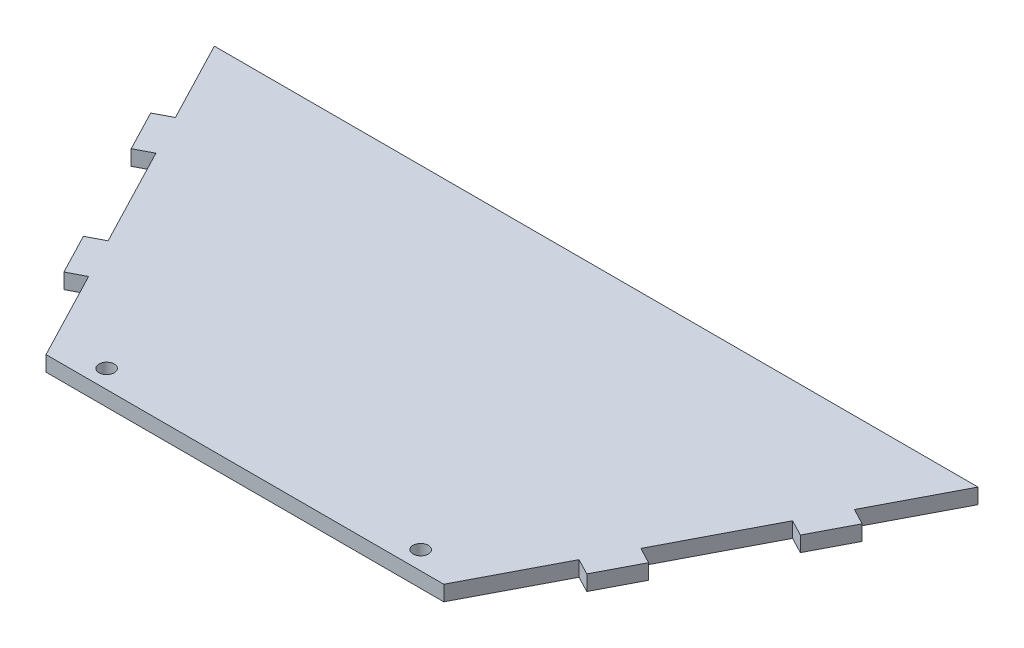
from build123d import *

# Parameters (mm, degrees)
EXTRUDE_1_DEPTH     = 5
SKETCH_2_R          = 2.5
CUT_EXTRUDE_1_DEPTH = 10


with BuildPart() as part:
    # 草图1 → 凸台-拉伸1 (new body)
    with BuildSketch(Plane(origin=(0, 0, 0), x_dir=(1, 0, 0), z_dir=(0, 1, 0))):
        Polygon((-65.115, -61.128005806), (65.115, -61.128005806), (80.27263574, -32.020080448), (85.594325618, -34.791292608), (92.522356018, -21.487067911), (87.200666139, -18.715855751), (104.215908801, 13.959320104), (109.53759868, 11.188107944), (116.465629079, 24.492332641), (111.143939201, 27.263544801), (125, 53.871994194), (-125, 53.871994194), (-111.143939201, 27.263544801), (-116.465629079, 24.492332641), (-109.53759868, 11.188107944), (-104.215908801, 13.959320104), (-87.200666139, -18.715855751), (-92.522356018, -21.487067911), (-85.594325618, -34.791292608), (-80.27263574, -32.020080448), align=None)
    extrude(amount=EXTRUDE_1_DEPTH)

    # 草图2 → 切除-拉伸1 (cut)
    with BuildSketch(Plane(origin=(0, 5, 0), x_dir=(1, 0, 0), z_dir=(0, 1, 0))):
        with Locations((-51.275, -55.118005806)):
            Circle(SKETCH_2_R)
        with Locations((51.525, -55.118005806)):
            Circle(SKETCH_2_R)
    extrude(amount=-CUT_EXTRUDE_1_DEPTH, mode=Mode.SUBTRACT)


solid = part.part
